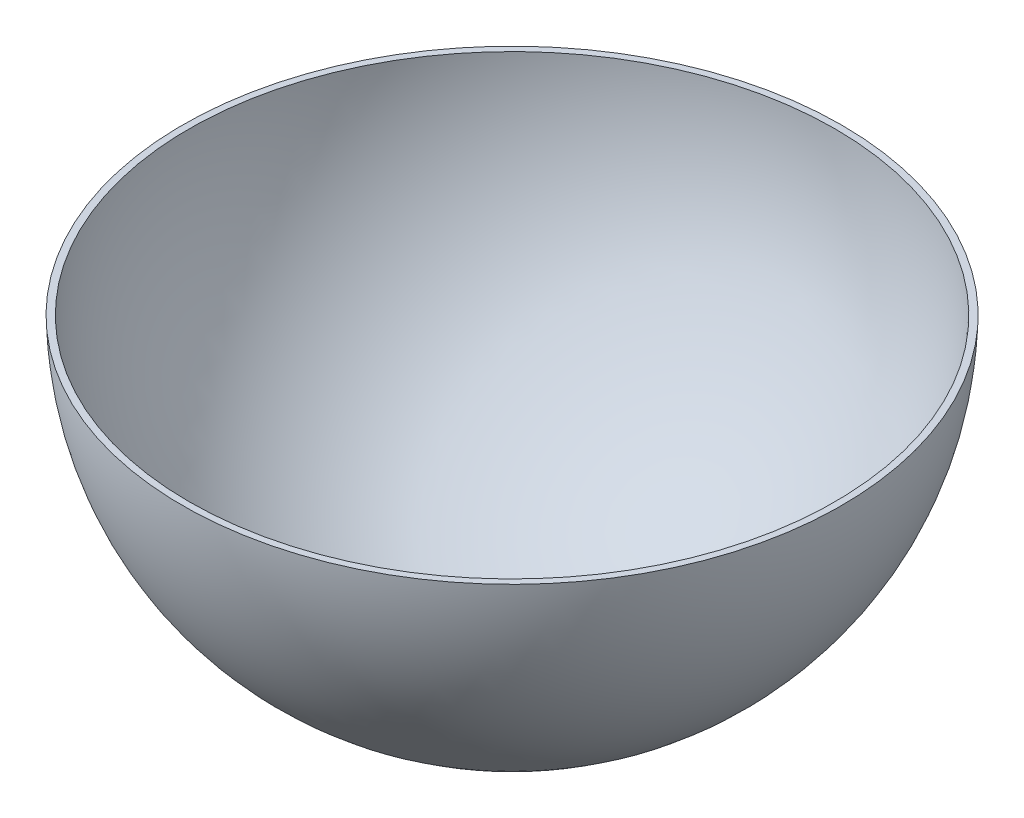
from build123d import *

# Parameters (mm, degrees)
CUT_EXTRUDE1_DEPTH      = 217.506350946
CUT_EXTRUDE1_DEPTH_BACK = 217.506350946
SKETCH2_W               = 329.482175278
SKETCH2_H               = 165.618230588


with BuildPart() as part:
    # Sketch1 → Revolve1 (revolve)
    with BuildSketch(Plane(origin=(0, 0, 0), x_dir=(0, 0, -1), z_dir=(1, 0, 0))):
        with BuildLine():
            Line((0, 122.5), (0, 125))
            ThreePointArc((0, 125), (-125, 0), (0, -125))
            Line((0, -125), (0, -122.5))
            ThreePointArc((0, -122.5), (-122.5, 0), (0, 122.5))
        make_face()
    revolve(axis=Axis((0, 125, 0), (0, -1, 0)))

    # Sketch2 → Cut-Extrude1 (cut, two sides: drawn at the far end of the back side and taken through both)
    with BuildSketch(Plane.XY.offset(-CUT_EXTRUDE1_DEPTH_BACK)):
        with Locations((4.118527191, 79.6153008)):
            Rectangle(SKETCH2_W, SKETCH2_H)
    extrude(amount=CUT_EXTRUDE1_DEPTH + CUT_EXTRUDE1_DEPTH_BACK, mode=Mode.SUBTRACT)


solid = part.part
